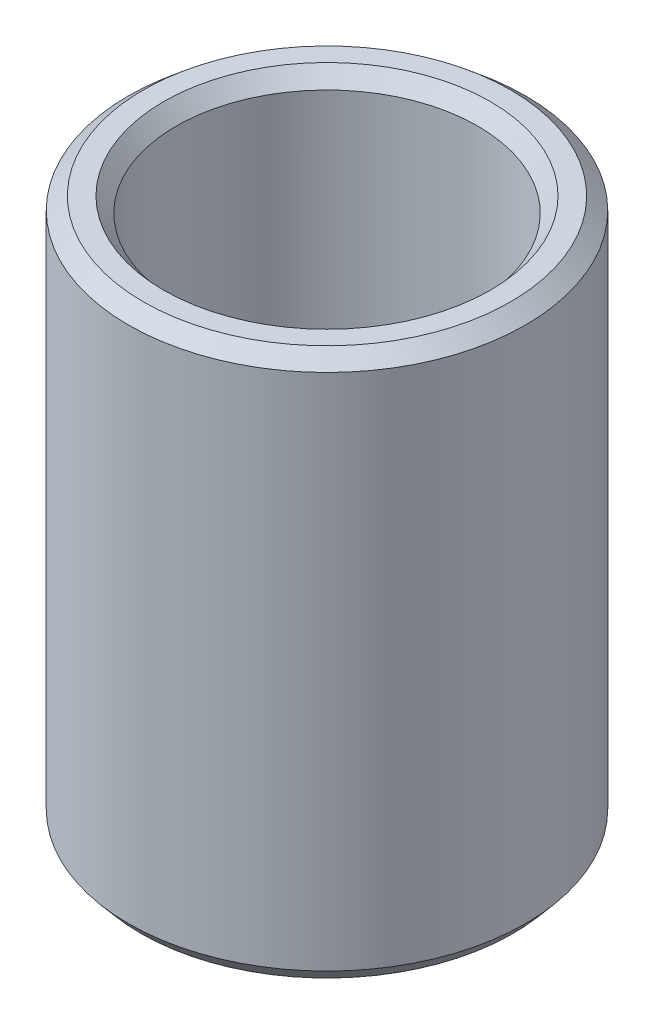
from build123d import *
from OCP.BRepFilletAPI import BRepFilletAPI_MakeChamfer

# Parameters (mm, degrees)
SKETCH1_R           = 27.5
BOSS_EXTRUDE1_DEPTH = 75.623331674
SKETCH2_R           = 20.888299084
CUT_EXTRUDE1_DEPTH  = 86.037569894
CHAMFER1_SIZE       = 1.743348849
CHAMFER1_SIZE2      = 2.067061981


with BuildPart() as part:
    # Sketch1 → Boss-Extrude1 (new body)
    with BuildSketch(Plane(origin=(0, 0, 0), x_dir=(1, 0, 0), z_dir=(0, 1, 0))):
        Circle(SKETCH1_R)
    extrude(amount=BOSS_EXTRUDE1_DEPTH)

    # Sketch2 → Cut-Extrude1 (cut, through all)
    with BuildSketch(Plane(origin=(0, 0, 0), x_dir=(1, 0, 0), z_dir=(0, 1, 0))):
        Circle(SKETCH2_R)
    extrude(amount=CUT_EXTRUDE1_DEPTH, mode=Mode.SUBTRACT)

    # Chamfer1: one chamfer whose edges measure the first distance from different faces: ONE call of the kernel's chamfer builder (chamfer() names one face for all edges)
    chamfer1_edges_1 = [part.edges().sort_by_distance(p)[0] for p in [
        (-20.888299084, 75.623331674, 0),
    ]]
    chamfer1_side_1 = [part.faces().sort_by_distance(p)[0] for p in [
        (-26.722182541, 75.623331674, 0),
    ]]
    chamfer1_edges_2 = [part.edges().sort_by_distance(p)[0] for p in [
        (-20.888299084, 0, 0),
    ]]
    chamfer1_side_2 = [part.faces().sort_by_distance(p)[0] for p in [
        (-20.888299084, 37.811665837, 0),
    ]]
    chamfer1_edges_3 = [part.edges().sort_by_distance(p)[0] for p in [
        (-27.5, 0, 0),
    ]]
    chamfer1_side_3 = [part.faces().sort_by_distance(p)[0] for p in [
        (-26.722182541, 0, 0),
    ]]
    chamfer1_edges_4 = [part.edges().sort_by_distance(p)[0] for p in [
        (-27.5, 75.623331674, 0),
    ]]
    chamfer1_side_4 = [part.faces().sort_by_distance(p)[0] for p in [
        (-27.5, 37.811665837, 0),
    ]]
    chamfer1 = BRepFilletAPI_MakeChamfer(part.part.solid().wrapped)
    for e in chamfer1_edges_1:
        chamfer1.Add(CHAMFER1_SIZE, CHAMFER1_SIZE2, e.wrapped, chamfer1_side_1[0].wrapped)  # the first distance lies on this face
    for e in chamfer1_edges_2:
        chamfer1.Add(CHAMFER1_SIZE, CHAMFER1_SIZE2, e.wrapped, chamfer1_side_2[0].wrapped)  # the first distance lies on this face
    for e in chamfer1_edges_3:
        chamfer1.Add(CHAMFER1_SIZE, CHAMFER1_SIZE2, e.wrapped, chamfer1_side_3[0].wrapped)  # the first distance lies on this face
    for e in chamfer1_edges_4:
        chamfer1.Add(CHAMFER1_SIZE, CHAMFER1_SIZE2, e.wrapped, chamfer1_side_4[0].wrapped)  # the first distance lies on this face
    add(Compound.cast(chamfer1.Shape()), mode=Mode.REPLACE)


solid = part.part
